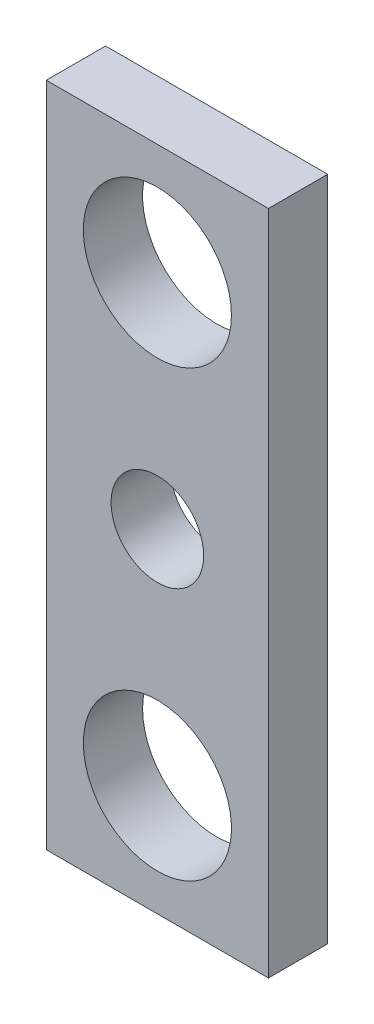
from build123d import *

# Parameters (mm, degrees)
SKETCH1_W           = 19.05
SKETCH1_H           = 57.15
SKETCH1_R           = 3.96875
SKETCH1_R_2         = 6.35
BOSS_EXTRUDE2_DEPTH = 5.08


with BuildPart() as part:
    # Sketch1 → Boss-Extrude2 (new body)
    with BuildSketch(Plane.XY):
        with Locations((0, -200.025)):
            Rectangle(SKETCH1_W, SKETCH1_H)
        with Locations((0, -200.025)):
            Circle(SKETCH1_R, mode=Mode.SUBTRACT)
        with Locations((0, -180.975)):
            Circle(SKETCH1_R_2, mode=Mode.SUBTRACT)
        with Locations((0, -219.075)):
            Circle(SKETCH1_R_2, mode=Mode.SUBTRACT)
    extrude(amount=BOSS_EXTRUDE2_DEPTH)


solid = part.part
